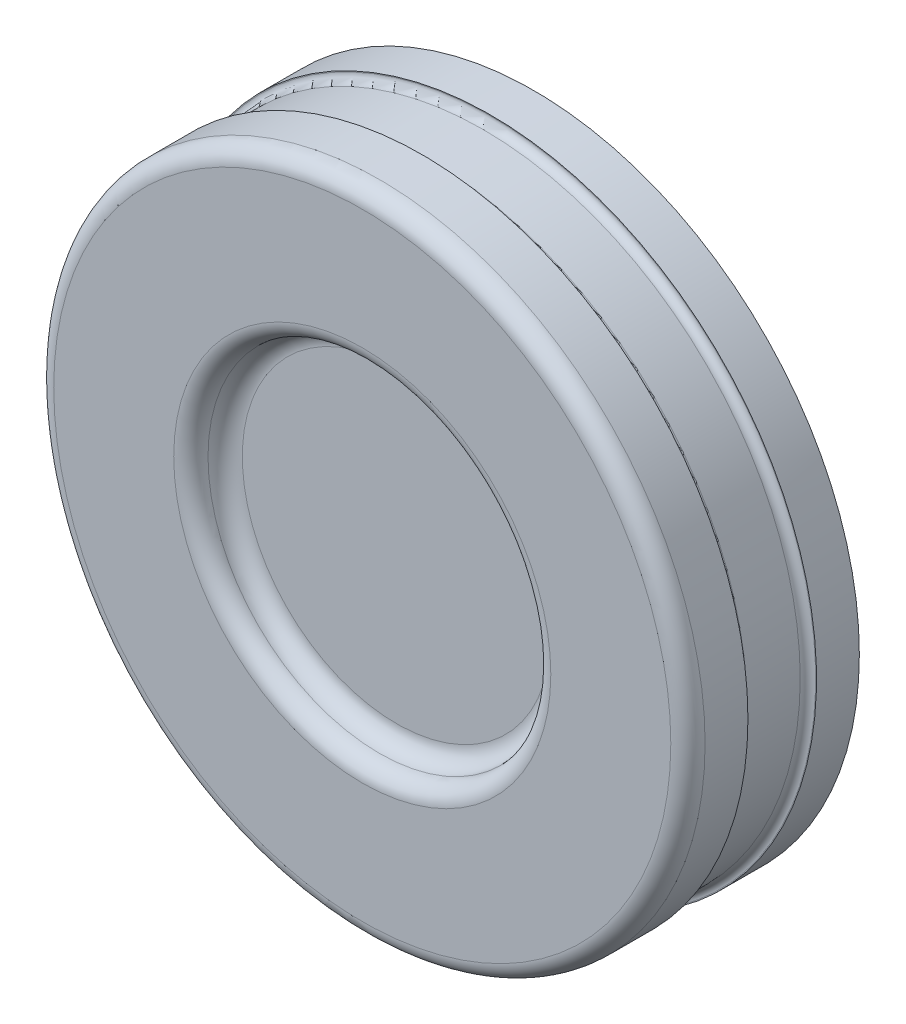
from build123d import *

# Parameters (mm, degrees)
SKETCH1_R           = 19
BOSS_EXTRUDE1_DEPTH = 10
SKETCH2_R           = 10
CUT_EXTRUDE1_DEPTH  = 2
FILLET1_R           = 1
SKETCH3_W           = 1
SKETCH3_H           = 4
FILLET2_R           = 0.45


with BuildPart() as part:
    # Sketch1 → Boss-Extrude1 (new body)
    with BuildSketch(Plane.XY):
        Circle(SKETCH1_R)
    extrude(amount=BOSS_EXTRUDE1_DEPTH)

    # Sketch2 → Cut-Extrude1 (cut)
    with BuildSketch(Plane.XY.offset(10)):
        Circle(SKETCH2_R)
    extrude(amount=-CUT_EXTRUDE1_DEPTH, mode=Mode.SUBTRACT)

    # Fillet1
    fillet1_edges = [part.edges().sort_by_distance(p)[0] for p in [
        (-19, 0, 10),
        (-10, 0, 8),
        (-10, 0, 10),
    ]]
    fillet(fillet1_edges, radius=FILLET1_R - 0.0001)  # a hair under: the kernel refuses the full size

    # Sketch3 → Cut-Revolve1 (revolve, cut)
    with BuildSketch(Plane(origin=(0, 0, 0), x_dir=(1, 0, 0), z_dir=(0, 1, 0)), mode=Mode.PRIVATE) as cut_revolve1_sk:
        with Locations((-19, -4.5)):
            Rectangle(SKETCH3_W, SKETCH3_H)
    revolve(cut_revolve1_sk.sketch.rotate(Axis((0, 0, 0), (0, 0, 1)), 180), axis=Axis((0, 0, 0), (0, 0, 1)), mode=Mode.SUBTRACT)

    # Fillet2
    fillet2_edges = [part.edges().sort_by_distance(p)[0] for p in [
        (-18.5, 0, 6.5),
        (-18.5, 0, 2.5),
    ]]
    fillet(fillet2_edges, radius=FILLET2_R)


solid = part.part
